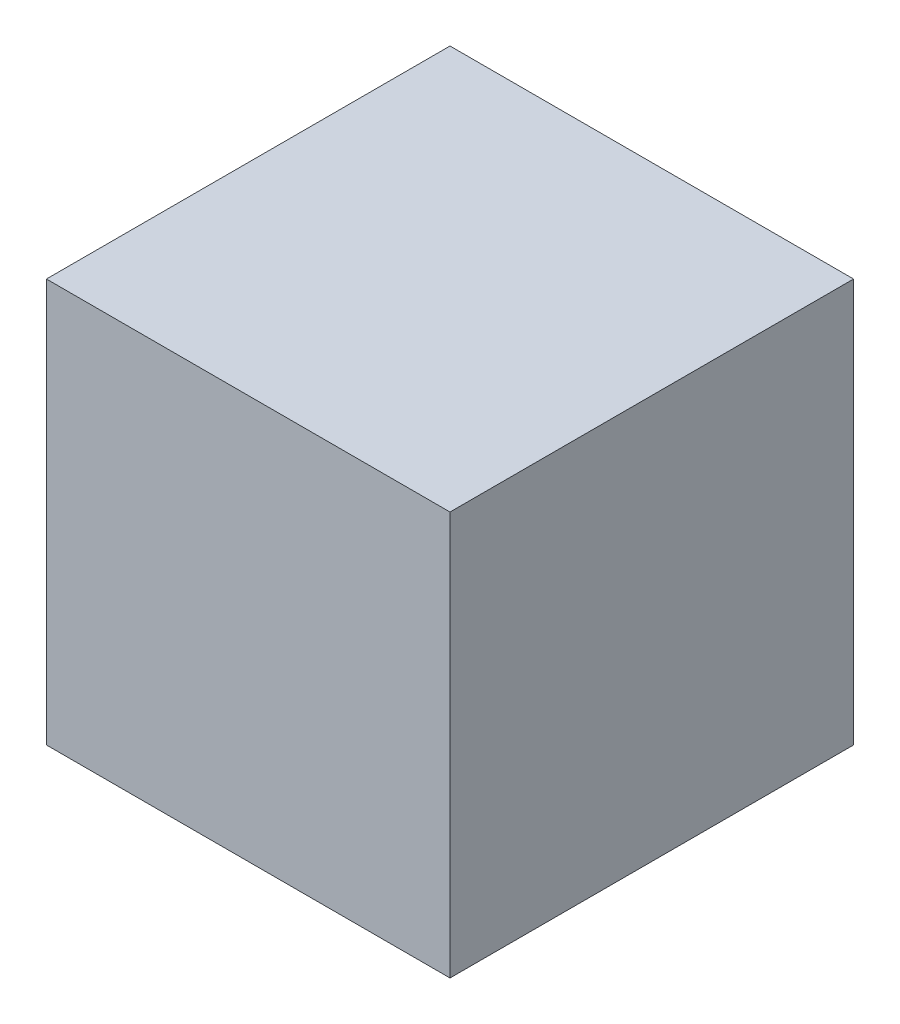
from build123d import *

# Parameters (mm, degrees)
SKETCH1_W           = 40
SKETCH1_H           = 40
BOSS_EXTRUDE1_DEPTH = 40
SKETCH2_R           = 1.59
CUT_EXTRUDE1_DEPTH  = 7


with BuildPart() as part:
    # Sketch1 → Boss-Extrude1 (new body)
    with BuildSketch(Plane.XY):
        Rectangle(SKETCH1_W, SKETCH1_H)
    extrude(amount=BOSS_EXTRUDE1_DEPTH)

    # Sketch2 → Cut-Extrude1 (cut)
    with BuildSketch(Plane(origin=(0, 20, 0), x_dir=(1, 0, 0), z_dir=(0, 0, 1))):
        with Locations((-14.08, -20)):
            Circle(SKETCH2_R)
        with Locations((14.5, -20)):
            Circle(SKETCH2_R)
    extrude(amount=CUT_EXTRUDE1_DEPTH, mode=Mode.SUBTRACT)


solid = part.part
